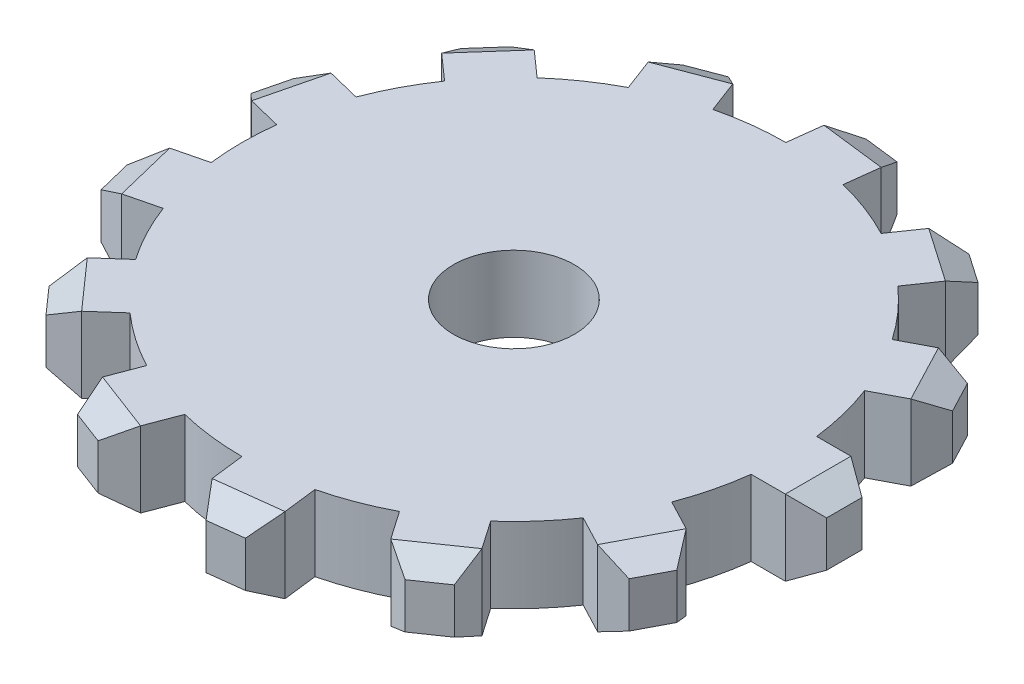
from build123d import *

# Parameters (mm, degrees)
SKETCH1_R                = 9
SKETCH1_R_2              = 2
BOSS_EXTRUDE1_DEPTH      = 2.5
BOSS_EXTRUDE2_START      = -2.5
BOSS_EXTRUDE2_DEPTH      = 2.5
CHAMFER1_SIZE            = 0.5
CHAMFER1_SIZE2           = 0.866025404
CIRPATTERN1_DEPTH        = 2.5
CIRPATTERN1_START        = -6
CIRPATTERN1_2_OUTLINE_W  = 5
CIRPATTERN1_2_OUTLINE_H  = 6
CIRPATTERN1_2_DEPTH      = 0.965822768
CIRPATTERN1_START_2      = -7.632253443
CIRPATTERN1_3_OUTLINE_W  = 5
CIRPATTERN1_3_OUTLINE_H  = 6
CIRPATTERN1_3_DEPTH      = 0.433012702
CIRPATTERN1_4_OUTLINE_W  = 5
CIRPATTERN1_4_OUTLINE_H  = 5
CIRPATTERN1_4_DEPTH      = 0.965822768
CIRPATTERN1_START_3      = -9
CIRPATTERN1_5_OUTLINE_W  = 5
CIRPATTERN1_5_OUTLINE_H  = 6
CIRPATTERN1_5_DEPTH      = 1.800759259
CIRPATTERN1_START_4      = -5.467189934
CIRPATTERN1_6_OUTLINE_W  = 5
CIRPATTERN1_6_OUTLINE_H  = 5
CIRPATTERN1_6_DEPTH      = 0.433012702
CIRPATTERN1_7_OUTLINE_W  = 6
CIRPATTERN1_7_OUTLINE_H  = 5
CIRPATTERN1_7_DEPTH      = 1.800759259
CIRPATTERN1_8_OUTLINE_W  = 5
CIRPATTERN1_8_OUTLINE_H  = 5
CIRPATTERN1_8_DEPTH      = 0.965822768
CIRPATTERN1_9_OUTLINE_W  = 6
CIRPATTERN1_9_OUTLINE_H  = 5
CIRPATTERN1_9_DEPTH      = 1.800759259
CIRPATTERN1_10_OUTLINE_W = 5
CIRPATTERN1_10_OUTLINE_H = 5
CIRPATTERN1_10_DEPTH     = 0.965822768
CIRPATTERN1_11_OUTLINE_W = 5
CIRPATTERN1_11_OUTLINE_H = 6
CIRPATTERN1_11_DEPTH     = 1.800759259
CIRPATTERN1_12_OUTLINE_W = 5
CIRPATTERN1_12_OUTLINE_H = 6
CIRPATTERN1_12_DEPTH     = 0.965822768
CIRPATTERN1_13_OUTLINE_W = 5
CIRPATTERN1_13_OUTLINE_H = 6
CIRPATTERN1_13_DEPTH     = 1.800759259
CIRPATTERN1_START_5      = 5.034177232
CIRPATTERN1_14_OUTLINE_W = 5
CIRPATTERN1_14_OUTLINE_H = 5
CIRPATTERN1_14_DEPTH     = 0.965822768
CIRPATTERN1_START_6      = 7.199240741
CIRPATTERN1_15_OUTLINE_W = 5
CIRPATTERN1_15_OUTLINE_H = 5
CIRPATTERN1_15_DEPTH     = 0.433012702
CIRPATTERN1_16_OUTLINE_W = 5
CIRPATTERN1_16_OUTLINE_H = 6
CIRPATTERN1_16_DEPTH     = 0.965822768
CIRPATTERN1_17_OUTLINE_W = 6
CIRPATTERN1_17_OUTLINE_H = 6
CIRPATTERN1_17_DEPTH     = 1.800759259
CIRPATTERN1_18_OUTLINE_W = 6
CIRPATTERN1_18_OUTLINE_H = 6
CIRPATTERN1_18_DEPTH     = 0.965822768
CIRPATTERN1_19_OUTLINE_W = 6
CIRPATTERN1_19_OUTLINE_H = 6
CIRPATTERN1_19_DEPTH     = 1.800759259
CIRPATTERN1_20_OUTLINE_W = 5
CIRPATTERN1_20_OUTLINE_H = 6
CIRPATTERN1_20_DEPTH     = 0.965822768
CIRPATTERN1_21_OUTLINE_W = 5
CIRPATTERN1_21_OUTLINE_H = 6
CIRPATTERN1_21_DEPTH     = 0.433012702
CIRPATTERN1_22_OUTLINE_W = 6
CIRPATTERN1_22_OUTLINE_H = 6
CIRPATTERN1_22_DEPTH     = 0.965822768
CIRPATTERN1_23_OUTLINE_W = 6
CIRPATTERN1_23_OUTLINE_H = 6
CIRPATTERN1_23_DEPTH     = 1.800759259
CIRPATTERN1_24_OUTLINE_W = 5
CIRPATTERN1_24_OUTLINE_H = 6
CIRPATTERN1_24_DEPTH     = 0.965822768
CIRPATTERN1_25_OUTLINE_W = 6
CIRPATTERN1_25_OUTLINE_H = 6
CIRPATTERN1_25_DEPTH     = 1.800759259


with BuildPart() as part:
    # Sketch1 → Boss-Extrude1 (new body)
    with BuildSketch(Plane(origin=(0, 0, 0), x_dir=(1, 0, 0), z_dir=(0, 1, 0))):
        with Locations(Location((0, 0, 0), (0, 0, 270))):
            Circle(SKETCH1_R)
        with Locations(Location((0, 0, 0), (0, 0, 270))):
            Circle(SKETCH1_R_2, mode=Mode.SUBTRACT)
    extrude(amount=BOSS_EXTRUDE1_DEPTH)

    # Sketch2 → Boss-Extrude2 (add)
    with BuildSketch(Plane(origin=(0, 2.5, 0), x_dir=(1, 0, 0), z_dir=(0, 1, 0)).offset(BOSS_EXTRUDE2_START)):
        with BuildLine():
            Line((0, 9), (0.241073361, 10.985417748))
            Line((0.241073361, 10.985417748), (2.394914339, 10.723894105))
            Line((2.394914339, 10.723894105), (2.153840979, 8.738476357))
            ThreePointArc((2.153840979, 8.738476357), (1.084830122, 8.934379867), (0, 9))
        make_face()
    extrude(amount=BOSS_EXTRUDE2_DEPTH)

    # Chamfer1
    chamfer1_edges = [part.edges().sort_by_distance(p)[0] for p in [
        (0.241073361, 1.25, -10.985417748),
        (2.394914339, 1.25, -10.723894105),
        (1.31799385, 2.5, -10.854655927),
        (1.31799385, 0, -10.854655927),
    ]]
    chamfer1_side = [part.faces().sort_by_distance(p)[0] for p in [
        (1.31799385, 1.25, -10.854655927),
    ]]
    chamfer(chamfer1_edges, length=CHAMFER1_SIZE, length2=CHAMFER1_SIZE2, reference=chamfer1_side[0])

    # CirPattern1: read off the stored shape, not the designer's step
    # CirPattern1 outline → CirPattern1 (add)
    with BuildSketch(Plane(origin=(0, 0, 0), x_dir=(1, 0, 0), z_dir=(0, 1, 0))):
        with BuildLine():
            Line((-4.424210201, 10.01643916), (-4.584621482, 9.029388897))
            Line((-4.584621482, 9.029388897), (-4.182508548, 7.969104231))
            ThreePointArc((-4.182508548, 7.969104231), (-3.191443983, 8.415146184), (-2.153840979, 8.738476357))
            Line((-2.153840979, 8.738476357), (-2.555953912, 9.798761023))
            Line((-2.555953912, 9.798761023), (-3.330558874, 10.431206399))
            Line((-3.330558874, 10.431206399), (-4.424210201, 10.01643916))
        make_face()
        with BuildLine():
            ThreePointArc((4.182508548, 7.969104232), (5.112582721, 7.406854794), (5.968103924, 6.736596734))
            Line((5.968103924, 6.736596734), (6.612274916, 7.669839531))
            Line((6.612274916, 7.669839531), (6.692741485, 8.666596839))
            Line((6.692741485, 8.666596839), (5.730129975, 9.331039589))
            Line((5.730129975, 9.331039589), (4.82667954, 8.902347028))
            Line((4.82667954, 8.902347028), (4.182508548, 7.969104232))
        make_face()
        with BuildLine():
            ThreePointArc((7.406854794, 5.112582721), (7.969104232, 4.182508549), (8.415146185, 3.191443983))
            Line((8.415146185, 3.191443983), (9.419230823, 3.718428255))
            Line((9.419230823, 3.718428255), (9.953696649, 4.56361834))
            Line((9.953696649, 4.56361834), (9.41012843, 5.599301052))
            Line((9.41012843, 5.599301052), (8.410939432, 5.639566992))
            Line((8.410939432, 5.639566992), (7.406854794, 5.112582721))
        make_face()
        with BuildLine():
            ThreePointArc((8.934379868, 1.084830122), (9.000000001, 0), (8.934379868, -1.084830122))
            Line((8.934379868, -1.084830122), (10.068354463, -1.084830122))
            Line((10.068354463, -1.084830122), (10.934379867, -0.584830122))
            Line((10.934379867, -0.584830122), (10.934379867, 0.584830122))
            Line((10.934379867, 0.584830122), (10.068354463, 1.084830122))
            Line((10.068354463, 1.084830122), (8.934379868, 1.084830122))
        make_face()
        with BuildLine():
            ThreePointArc((8.415146185, -3.191443984), (7.969104232, -4.182508549), (7.406854794, -5.112582721))
            Line((7.406854794, -5.112582721), (8.410939432, -5.639566992))
            Line((8.410939432, -5.639566992), (9.41012843, -5.599301052))
            Line((9.41012843, -5.599301052), (9.953696649, -4.56361834))
            Line((9.953696649, -4.56361834), (9.419230823, -3.718428255))
            Line((9.419230823, -3.718428255), (8.415146185, -3.191443984))
        make_face()
        with BuildLine():
            ThreePointArc((5.968103924, -6.736596734), (5.112582721, -7.406854794), (4.182508548, -7.969104232))
            Line((4.182508548, -7.969104232), (4.82667954, -8.902347028))
            Line((4.82667954, -8.902347028), (5.730129975, -9.331039589))
            Line((5.730129975, -9.331039589), (6.692741485, -8.666596839))
            Line((6.692741485, -8.666596839), (6.612274916, -7.669839531))
            Line((6.612274916, -7.669839531), (5.968103924, -6.736596734))
        make_face()
        with BuildLine():
            ThreePointArc((2.153840979, -8.738476357), (1.084830123, -8.934379867), (0, -9))
            Line((0, -9), (0.136685533, -10.125706645))
            Line((0.136685533, -10.125706645), (0.737427798, -10.925149408))
            Line((0.737427798, -10.925149408), (1.898559902, -10.784162445))
            Line((1.898559902, -10.784162445), (2.290526512, -9.864183001))
            Line((2.290526512, -9.864183001), (2.153840979, -8.738476357))
        make_face()
        with BuildLine():
            ThreePointArc((-2.153840979, -8.738476357), (-3.191443983, -8.415146184), (-4.182508548, -7.969104231))
            Line((-4.182508548, -7.969104231), (-4.584621482, -9.029388897))
            Line((-4.584621482, -9.029388897), (-4.424210201, -10.01643916))
            Line((-4.424210201, -10.01643916), (-3.330558874, -10.431206399))
            Line((-3.330558874, -10.431206399), (-2.555953912, -9.798761023))
            Line((-2.555953912, -9.798761023), (-2.153840979, -8.738476357))
        make_face()
        with BuildLine():
            ThreePointArc((-5.968103923, -6.736596733), (-6.736596733, -5.968103924), (-7.406854792, -5.11258272))
            Line((-7.406854792, -5.11258272), (-8.255646966, -5.864546969))
            Line((-8.255646966, -5.864546969), (-8.57231496, -6.813083411))
            Line((-8.57231496, -6.813083411), (-7.79668675, -7.688586676))
            Line((-7.79668675, -7.688586676), (-6.816896098, -7.488560982))
            Line((-6.816896098, -7.488560982), (-5.968103923, -6.736596733))
        make_face()
        with BuildLine():
            ThreePointArc((-8.415146183, -3.191443983), (-8.738476356, -2.153840978), (-8.934379866, -1.084830122))
            Line((-8.934379866, -1.084830122), (-10.035403222, -1.356208006))
            Line((-10.035403222, -1.356208006), (-10.75660567, -2.04893236))
            Line((-10.75660567, -2.04893236), (-10.476687651, -3.184604403))
            Line((-10.476687651, -3.184604403), (-9.51616954, -3.462821867))
            Line((-9.51616954, -3.462821867), (-8.415146183, -3.191443983))
        make_face()
        with BuildLine():
            ThreePointArc((-8.934379866, 1.084830122), (-8.738476356, 2.153840978), (-8.415146183, 3.191443983))
            Line((-8.415146183, 3.191443983), (-9.51616954, 3.462821867))
            Line((-9.51616954, 3.462821867), (-10.476687651, 3.184604403))
            Line((-10.476687651, 3.184604403), (-10.75660567, 2.04893236))
            Line((-10.75660567, 2.04893236), (-10.035403222, 1.356208006))
            Line((-10.035403222, 1.356208006), (-8.934379866, 1.084830122))
        make_face()
        with BuildLine():
            ThreePointArc((-7.406854792, 5.11258272), (-6.736596733, 5.968103924), (-5.968103923, 6.736596733))
            Line((-5.968103923, 6.736596733), (-6.816896098, 7.488560982))
            Line((-6.816896098, 7.488560982), (-7.79668675, 7.688586676))
            Line((-7.79668675, 7.688586676), (-8.57231496, 6.813083411))
            Line((-8.57231496, 6.813083411), (-8.255646966, 5.864546969))
            Line((-8.255646966, 5.864546969), (-7.406854792, 5.11258272))
        make_face()
    extrude(amount=CIRPATTERN1_DEPTH)

    # CirPattern1 2 outline → CirPattern1 2 (cut)
    with BuildSketch(Plane(origin=(0, 0, 0), x_dir=(0.984156412122274, -0.15602034224555472, -0.08422475458078069), z_dir=(0.17730244352126895, 0.8660254037844377, 0.4675081213427088)).offset(CIRPATTERN1_START)):
        with Locations((-2.5, 9)):
            Rectangle(CIRPATTERN1_2_OUTLINE_W, CIRPATTERN1_2_OUTLINE_H)
    extrude(amount=CIRPATTERN1_2_DEPTH, mode=Mode.SUBTRACT)

    # CirPattern1 3 outline → CirPattern1 3 (cut)
    with BuildSketch(Plane(origin=(0, 0, 0), x_dir=(0.984156412122274, 0.15602034224555472, -0.08422475458078069), z_dir=(0.17730244352126895, -0.8660254037844377, 0.4675081213427088)).offset(CIRPATTERN1_START_2)):
        with Locations((-2.5, -8)):
            Rectangle(CIRPATTERN1_3_OUTLINE_W, CIRPATTERN1_3_OUTLINE_H)
    extrude(amount=CIRPATTERN1_3_DEPTH, mode=Mode.SUBTRACT)

    # CirPattern1 4 outline → CirPattern1 4 (cut)
    with BuildSketch(Plane(origin=(0, 0, 0), x_dir=(0.9273256790190187, -0.3495154602035865, -0.13381340781323425), z_dir=(0.37425537408555104, 0.8660254037844392, 0.33156132912039604)).offset(CIRPATTERN1_START)):
        with Locations((-6.5, 6.5)):
            Rectangle(CIRPATTERN1_4_OUTLINE_W, CIRPATTERN1_4_OUTLINE_H)
    extrude(amount=CIRPATTERN1_4_DEPTH, mode=Mode.SUBTRACT)

    # CirPattern1 5 outline → CirPattern1 5 (cut)
    with BuildSketch(Plane(origin=(0, 0, 0), x_dir=(0.9273256790190192, 0.3495154602035857, -0.13381340781323395), z_dir=(0.3742553740855502, -0.8660254037844394, 0.33156132912039615)).offset(CIRPATTERN1_START_3)):
        with Locations((-5.5, -6)):
            Rectangle(CIRPATTERN1_5_OUTLINE_W, CIRPATTERN1_5_OUTLINE_H)
    extrude(amount=CIRPATTERN1_5_DEPTH, mode=Mode.SUBTRACT)

    # CirPattern1 6 outline → CirPattern1 6 (cut)
    with BuildSketch(Plane(origin=(0, 0, 0), x_dir=(0.8742528220105147, -0.48090223921375025, -0.06644576379162259), z_dir=(0.48547090871302595, 0.866025403784439, 0.11965783214377698)).offset(CIRPATTERN1_START_4)):
        with Locations((-9.5, 2.5)):
            Rectangle(CIRPATTERN1_6_OUTLINE_W, CIRPATTERN1_6_OUTLINE_H)
    extrude(amount=CIRPATTERN1_6_DEPTH, mode=Mode.SUBTRACT)

    # CirPattern1 7 outline → CirPattern1 7 (cut)
    with BuildSketch(Plane(origin=(0, 0, 0), x_dir=(0.8742528220105142, 0.4809022392137511, -0.06644576379162273), z_dir=(0.48547090871302684, -0.8660254037844385, 0.11965783214377695)).offset(CIRPATTERN1_START_3)):
        with Locations((-8, -2.5)):
            Rectangle(CIRPATTERN1_7_OUTLINE_W, CIRPATTERN1_7_OUTLINE_H)
    extrude(amount=CIRPATTERN1_7_DEPTH, mode=Mode.SUBTRACT)

    # CirPattern1 8 outline → CirPattern1 8 (cut)
    with BuildSketch(Plane(origin=(0, 0, 0), x_dir=(0.8742528220105146, -0.48090223921375014, 0.06644576379162488), z_dir=(0.4854709087130262, 0.8660254037844384, -0.11965783214378103)).offset(CIRPATTERN1_START)):
        with Locations((-9.5, -2.5)):
            Rectangle(CIRPATTERN1_8_OUTLINE_W, CIRPATTERN1_8_OUTLINE_H)
    extrude(amount=CIRPATTERN1_8_DEPTH, mode=Mode.SUBTRACT)

    # CirPattern1 9 outline → CirPattern1 9 (cut)
    with BuildSketch(Plane(origin=(0, 0, 0), x_dir=(0.8742528220105146, 0.48090223921375014, 0.06644576379162488), z_dir=(0.4854709087130262, -0.8660254037844384, -0.11965783214378103)).offset(CIRPATTERN1_START_3)):
        with Locations((-8, 2.5)):
            Rectangle(CIRPATTERN1_9_OUTLINE_W, CIRPATTERN1_9_OUTLINE_H)
    extrude(amount=CIRPATTERN1_9_DEPTH, mode=Mode.SUBTRACT)

    # CirPattern1 10 outline → CirPattern1 10 (cut)
    with BuildSketch(Plane(origin=(0, 0, 0), x_dir=(0.9273256790190201, -0.34951546020358326, 0.13381340781323425), z_dir=(0.37425537408554804, 0.8660254037844393, -0.3315613291203991)).offset(CIRPATTERN1_START)):
        with Locations((-6.5, -6.5)):
            Rectangle(CIRPATTERN1_10_OUTLINE_W, CIRPATTERN1_10_OUTLINE_H)
    extrude(amount=CIRPATTERN1_10_DEPTH, mode=Mode.SUBTRACT)

    # CirPattern1 11 outline → CirPattern1 11 (cut)
    with BuildSketch(Plane(origin=(0, 0, 0), x_dir=(0.9273256790190201, 0.34951546020358326, 0.13381340781323425), z_dir=(0.37425537408554804, -0.8660254037844393, -0.3315613291203991)).offset(CIRPATTERN1_START_3)):
        with Locations((-5.5, 6)):
            Rectangle(CIRPATTERN1_11_OUTLINE_W, CIRPATTERN1_11_OUTLINE_H)
    extrude(amount=CIRPATTERN1_11_DEPTH, mode=Mode.SUBTRACT)

    # CirPattern1 12 outline → CirPattern1 12 (cut)
    with BuildSketch(Plane(origin=(0, 0, 0), x_dir=(0.9841564121222747, -0.15602034224555122, 0.08422475458077869), z_dir=(0.17730244352126492, 0.8660254037844386, -0.4675081213427087)).offset(CIRPATTERN1_START)):
        with Locations((-2.5, -9)):
            Rectangle(CIRPATTERN1_12_OUTLINE_W, CIRPATTERN1_12_OUTLINE_H)
    extrude(amount=CIRPATTERN1_12_DEPTH, mode=Mode.SUBTRACT)

    # CirPattern1 13 outline → CirPattern1 13 (cut)
    with BuildSketch(Plane(origin=(0, 0, 0), x_dir=(0.9841564121222747, 0.15602034224555134, 0.08422475458077885), z_dir=(0.1773024435212651, -0.8660254037844384, -0.4675081213427092)).offset(CIRPATTERN1_START_3)):
        with Locations((-2.5, 8)):
            Rectangle(CIRPATTERN1_13_OUTLINE_W, CIRPATTERN1_13_OUTLINE_H)
    extrude(amount=CIRPATTERN1_13_DEPTH, mode=Mode.SUBTRACT)

    # CirPattern1 14 outline → CirPattern1 14 (cut)
    with BuildSketch(Plane(origin=(0, 0, 0), x_dir=(0.9981822114114517, 0.05228896387632066, -0.029968935224408574), z_dir=(0.0602683401276654, -0.8660254037844379, 0.49635443704902793)).offset(CIRPATTERN1_START_5)):
        with Locations((0.5, 9.5)):
            Rectangle(CIRPATTERN1_14_OUTLINE_W, CIRPATTERN1_14_OUTLINE_H)
    extrude(amount=CIRPATTERN1_14_DEPTH, mode=Mode.SUBTRACT)

    # CirPattern1 15 outline → CirPattern1 15 (cut)
    with BuildSketch(Plane(origin=(0, 0, 0), x_dir=(0.9981822114114517, -0.05228896387632066, -0.029968935224408574), z_dir=(0.0602683401276654, 0.8660254037844379, 0.49635443704902793)).offset(CIRPATTERN1_START_6)):
        with Locations((0.5, -8.5)):
            Rectangle(CIRPATTERN1_15_OUTLINE_W, CIRPATTERN1_15_OUTLINE_H)
    extrude(amount=CIRPATTERN1_15_DEPTH, mode=Mode.SUBTRACT)

    # CirPattern1 16 outline → CirPattern1 16 (cut)
    with BuildSketch(Plane(origin=(0, 0, 0), x_dir=(0.9588146905843248, 0.2565451418791621, -0.1218974130073563), z_dir=(0.28403237336558207, -0.8660254037844384, 0.4114919329468262)).offset(CIRPATTERN1_START_5)):
        with Locations((4.5, 8)):
            Rectangle(CIRPATTERN1_16_OUTLINE_W, CIRPATTERN1_16_OUTLINE_H)
    extrude(amount=CIRPATTERN1_16_DEPTH, mode=Mode.SUBTRACT)

    # CirPattern1 17 outline → CirPattern1 17 (cut)
    with BuildSketch(Plane(origin=(0, 0, 0), x_dir=(0.9588146905843248, -0.256545141879162, -0.12189741300735611), z_dir=(0.2840323733655819, 0.8660254037844386, 0.41149193294682584)).offset(CIRPATTERN1_START_6)):
        with Locations((4, -7)):
            Rectangle(CIRPATTERN1_17_OUTLINE_W, CIRPATTERN1_17_OUTLINE_H)
    extrude(amount=CIRPATTERN1_17_DEPTH, mode=Mode.SUBTRACT)

    # CirPattern1 18 outline → CirPattern1 18 (cut)
    with BuildSketch(Plane(origin=(0, 0, 0), x_dir=(0.8966559578002048, 0.4276040355717775, -0.1147296043056335), z_dir=(0.442728012826608, -0.866025403784438, 0.23236158602188103)).offset(CIRPATTERN1_START_5)):
        with Locations((8, 5)):
            Rectangle(CIRPATTERN1_18_OUTLINE_W, CIRPATTERN1_18_OUTLINE_H)
    extrude(amount=CIRPATTERN1_18_DEPTH, mode=Mode.SUBTRACT)

    # CirPattern1 19 outline → CirPattern1 19 (cut)
    with BuildSketch(Plane(origin=(0, 0, 0), x_dir=(0.8966559578002048, -0.42760403557177773, -0.11472960430563307), z_dir=(0.4427280128266081, 0.8660254037844383, 0.2323615860218801)).offset(CIRPATTERN1_START_6)):
        with Locations((7, -4)):
            Rectangle(CIRPATTERN1_19_OUTLINE_W, CIRPATTERN1_19_OUTLINE_H)
    extrude(amount=CIRPATTERN1_19_DEPTH, mode=Mode.SUBTRACT)

    # CirPattern1 20 outline → CirPattern1 20 (cut)
    with BuildSketch(Plane(origin=(0, 0, 0), x_dir=(0.8660254037844386, 0.4999999999999999, 0), z_dir=(0.4999999999999999, -0.8660254037844388, 0)).offset(CIRPATTERN1_START_5)):
        with Locations((9.5, 0)):
            Rectangle(CIRPATTERN1_20_OUTLINE_W, CIRPATTERN1_20_OUTLINE_H)
    extrude(amount=CIRPATTERN1_20_DEPTH, mode=Mode.SUBTRACT)

    # CirPattern1 21 outline → CirPattern1 21 (cut)
    with BuildSketch(Plane(origin=(0, 0, 0), x_dir=(0.8660254037844386, -0.4999999999999999, 0), z_dir=(0.4999999999999999, 0.8660254037844388, 0)).offset(CIRPATTERN1_START_6)):
        with Locations((8.5, 0)):
            Rectangle(CIRPATTERN1_21_OUTLINE_W, CIRPATTERN1_21_OUTLINE_H)
    extrude(amount=CIRPATTERN1_21_DEPTH, mode=Mode.SUBTRACT)

    # CirPattern1 22 outline → CirPattern1 22 (cut)
    with BuildSketch(Plane(origin=(0, 0, 0), x_dir=(0.8966559578002079, 0.4276040355717707, 0.11472960430563549), z_dir=(0.44272801282660196, -0.8660254037844389, -0.232361586021889)).offset(CIRPATTERN1_START_5)):
        with Locations((8, -5)):
            Rectangle(CIRPATTERN1_22_OUTLINE_W, CIRPATTERN1_22_OUTLINE_H)
    extrude(amount=CIRPATTERN1_22_DEPTH, mode=Mode.SUBTRACT)

    # CirPattern1 23 outline → CirPattern1 23 (cut)
    with BuildSketch(Plane(origin=(0, 0, 0), x_dir=(0.8966559578002083, -0.42760403557177, 0.1147296043056353), z_dir=(0.4427280128266012, 0.8660254037844394, -0.23236158602188908)).offset(CIRPATTERN1_START_6)):
        with Locations((7, 4)):
            Rectangle(CIRPATTERN1_23_OUTLINE_W, CIRPATTERN1_23_OUTLINE_H)
    extrude(amount=CIRPATTERN1_23_DEPTH, mode=Mode.SUBTRACT)

    # CirPattern1 24 outline → CirPattern1 24 (cut)
    with BuildSketch(Plane(origin=(0, 0, 0), x_dir=(0.9588146905843272, 0.25654514187915395, 0.12189741300735493), z_dir=(0.2840323733655741, -0.8660254037844373, -0.4114919329468341)).offset(CIRPATTERN1_START_5)):
        with Locations((4.5, -8)):
            Rectangle(CIRPATTERN1_24_OUTLINE_W, CIRPATTERN1_24_OUTLINE_H)
    extrude(amount=CIRPATTERN1_24_DEPTH, mode=Mode.SUBTRACT)

    # CirPattern1 25 outline → CirPattern1 25 (cut)
    with BuildSketch(Plane(origin=(0, 0, 0), x_dir=(0.9588146905843271, -0.2565451418791541, 0.12189741300735471), z_dir=(0.2840323733655742, 0.8660254037844375, -0.4114919329468332)).offset(CIRPATTERN1_START_6)):
        with Locations((4, 7)):
            Rectangle(CIRPATTERN1_25_OUTLINE_W, CIRPATTERN1_25_OUTLINE_H)
    extrude(amount=CIRPATTERN1_25_DEPTH, mode=Mode.SUBTRACT)


solid = part.part
